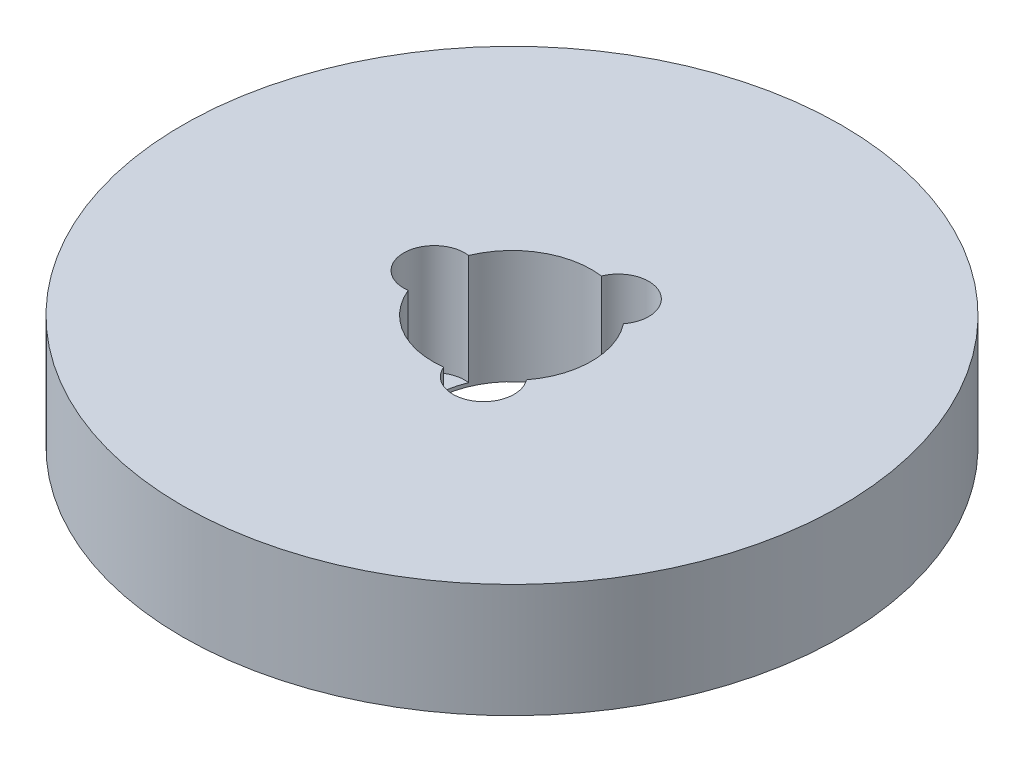
from build123d import *

# Parameters (mm, degrees)
SKETCH1_R           = 72.5
BOSS_EXTRUDE1_DEPTH = 25
SKETCH2_R           = 17.5
CUT_EXTRUDE1_DEPTH  = 106.534354596
SKETCH3_R           = 6.721755304
CUT_EXTRUDE2_DEPTH  = 24.234624301
CIRPATTERN1_COUNT   = 3


with BuildPart() as part:
    # Sketch1 → Boss-Extrude1 (new body)
    with BuildSketch(Plane(origin=(0, 0, 0), x_dir=(1, 0, 0), z_dir=(0, 1, 0))):
        Circle(SKETCH1_R)
    extrude(amount=BOSS_EXTRUDE1_DEPTH)

    # Sketch2 → Cut-Extrude1 (cut, through all)
    with BuildSketch(Plane(origin=(0, 0, 0), x_dir=(1, 0, 0), z_dir=(0, 1, 0))):
        Circle(SKETCH2_R)
    extrude(amount=CUT_EXTRUDE1_DEPTH, mode=Mode.SUBTRACT)

    # Sketch3 → Cut-Extrude2 (cut)
    with BuildSketch(Plane(origin=(0, 25, 0), x_dir=(1, 0, 0), z_dir=(0, 1, 0))):
        with Locations((-17.104622237, 0)):
            Circle(SKETCH3_R)
    cut_extrude2 = extrude(amount=-CUT_EXTRUDE2_DEPTH, mode=Mode.SUBTRACT)

    # CirPattern1: Cut-Extrude2 ×3 about axis
    cirpattern1_axis = Axis((0, 0, 0), (0, 1, 0))
    for i in range(1, CIRPATTERN1_COUNT):
        add(cut_extrude2.rotate(cirpattern1_axis, i * 360 / CIRPATTERN1_COUNT), mode=Mode.SUBTRACT)


solid = part.part
